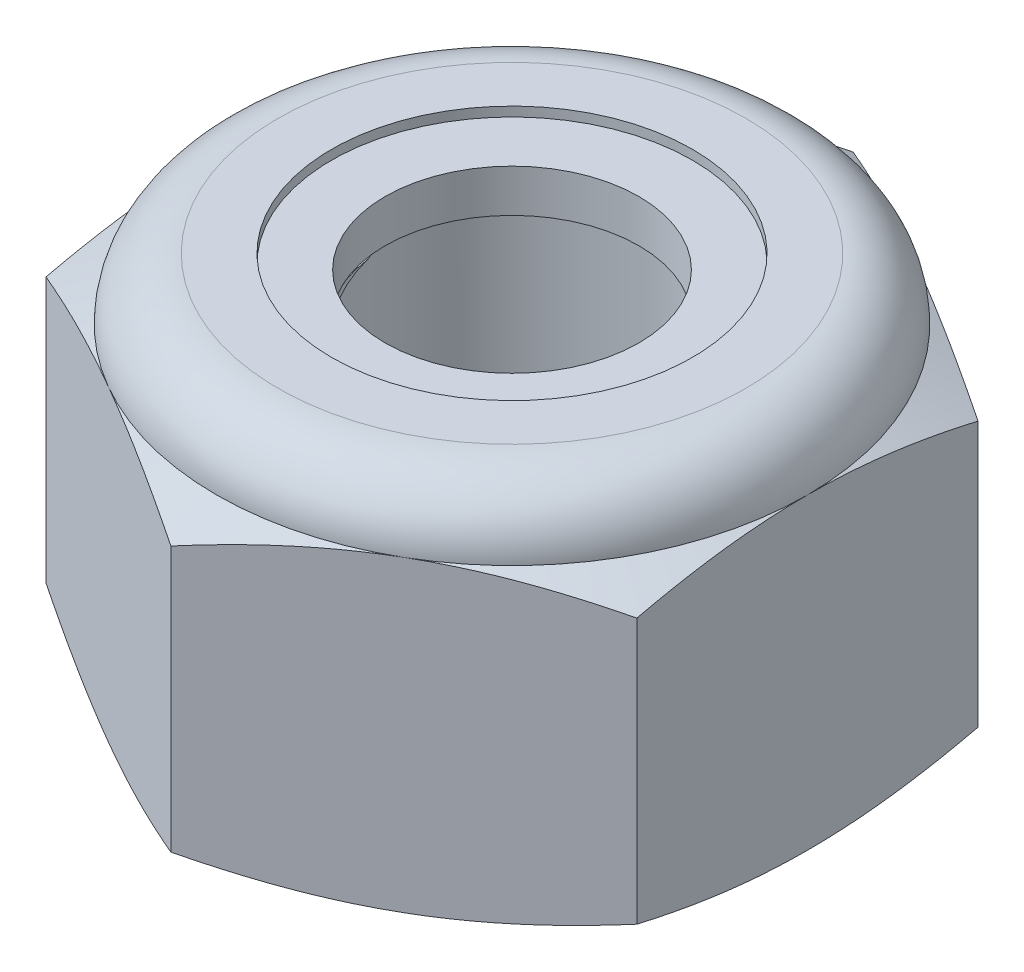
from build123d import *

# Parameters (mm, degrees)
EXTRUDE1_DEPTH = 5.953125
SKETCH2_W      = 2.413
SKETCH2_H      = 5.953125


with BuildPart() as part:
    # Sketch1 → Extrude1 (new body)
    with BuildSketch(Plane(origin=(0, 0, 0), x_dir=(1, 0, 0), z_dir=(0, 1, 0))):
        Polygon((0, 5.499261314), (-4.7625, 2.749630657), (-4.7625, -2.749630657), (0, -5.499261314), (4.7625, -2.749630657), (4.7625, 2.749630657), align=None)
    extrude(amount=EXTRUDE1_DEPTH)


with BuildPart() as body_2:
    # Sketch2 → Revolve1 (revolve)
    with BuildSketch(Plane(origin=(0, 0, 0), x_dir=(0, 0, -1), z_dir=(1, 0, 0))):
        with Locations((1.2065, 2.9765625)):
            Rectangle(SKETCH2_W, SKETCH2_H)
    revolve(axis=Axis((0, -2.413, 0), (0, 1, 0)))

    # Sketch3 → Cut-Revolve1 (revolve, cut)
    with BuildSketch(Plane(origin=(0, 0, 0), x_dir=(0, 0, -1), z_dir=(1, 0, 0))):
        Polygon((2.429102527, 5.855221635), (2.541820218, 5.169898076), (2.077629892, 5.344930502), (2.045424837, 5.540737233), align=None)
    revolve(axis=Axis((0, 5.953125, 0.139697061), (0, -0.9867425810390564, -0.16229318767089773)), mode=Mode.SUBTRACT)


with BuildPart() as part_1:
    add(part.part)

    # Combine1: cut body 2
    add(body_2.part, mode=Mode.SUBTRACT)

    # Sketch5 → Cut-Revolve3 (revolve, cut)
    with BuildSketch(Plane(origin=(0, 0, 0), x_dir=(0, 0, -1), z_dir=(1, 0, 0))):
        with BuildLine():
            Line((0, 0), (4.7625, 0))
            Line((4.7625, 0), (5.499261314, 0.343557443))
            Line((5.499261314, 0.343557443), (5.499261314, 4.617380057))
            Line((5.499261314, 4.617380057), (4.7625, 4.9609375))
            ThreePointArc((4.7625, 4.9609375), (4.471895009, 5.662520009), (3.7703125, 5.953125))
            Line((3.7703125, 5.953125), (3.7703125, 7.223125))
            Line((3.7703125, 7.223125), (6.769261314, 7.223125))
            Line((6.769261314, 7.223125), (6.769261314, -1.27))
            Line((6.769261314, -1.27), (0, -1.27))
            Line((0, -1.27), (0, 0))
        make_face()
    revolve(axis=Axis((0, 0, 0), (0, 1, 0)), mode=Mode.SUBTRACT)

    # Sketch6 → Cut-Revolve4 (revolve, cut)
    with BuildSketch(Plane(origin=(0, 0, 0), x_dir=(0, 0, -1), z_dir=(1, 0, 0))):
        with BuildLine():
            Line((0, 4.9609375), (4.6101, 4.9609375))
            ThreePointArc((4.6101, 4.9609375), (4.364131936, 5.554756936), (3.7703125, 5.800725))
            Line((3.7703125, 5.800725), (2.907868669, 5.800725))
            Line((2.907868669, 5.800725), (2.907868669, 7.223125))
            Line((2.907868669, 7.223125), (0, 7.223125))
            Line((0, 7.223125), (0, 4.9609375))
        make_face()
    revolve(axis=Axis((0, 7.223125, 0), (0, 1, 0)), mode=Mode.SUBTRACT)


with BuildPart() as body_2_2:
    # Sketch7 → Revolve2 (revolve)
    with BuildSketch(Plane(origin=(0, 0, 0), x_dir=(0, 0, -1), z_dir=(1, 0, 0))):
        with BuildLine():
            Line((2.045424837, 5.0371375), (4.530088408, 5.0371375))
            ThreePointArc((4.530088408, 5.0371375), (4.282601726, 5.527175629), (3.7703125, 5.724525))
            Line((3.7703125, 5.724525), (2.045424837, 5.724525))
            Line((2.045424837, 5.724525), (2.045424837, 5.0371375))
        make_face()
    revolve(axis=Axis((0, 5.0371375, 0), (0, 1, 0)))


solid = Compound([part_1.part, body_2_2.part])
